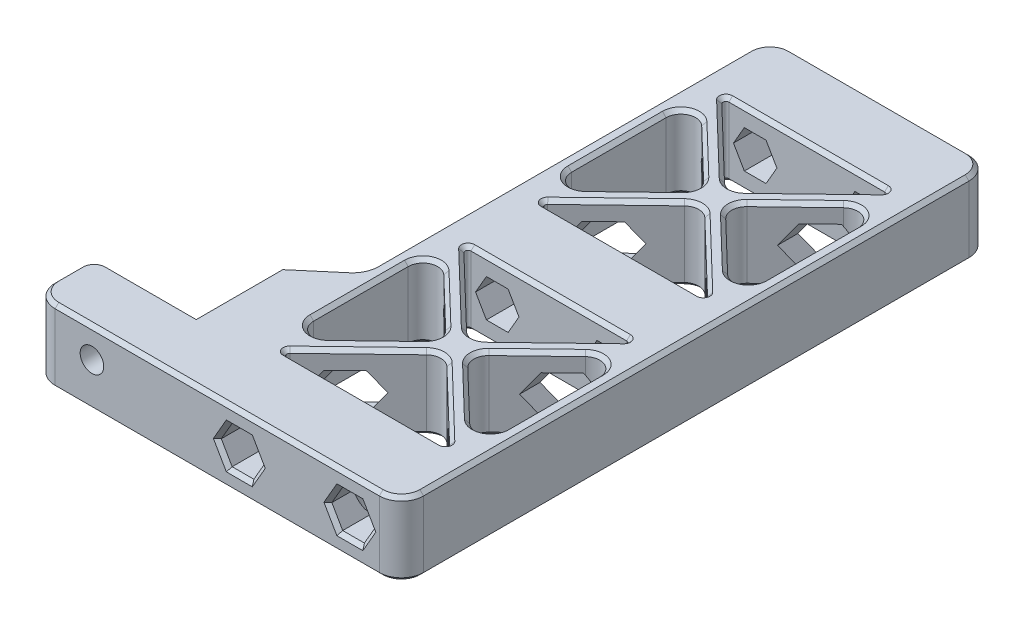
from build123d import *

# Parameters (mm, degrees)
SKETCH1_W               = 63.5
SKETCH1_H               = 101.6
BOSS_EXTRUDE1_DEPTH     = 12.7
CUT_EXTRUDE1_REACH      = 109.2
CUT_EXTRUDE3_DEPTH      = 62.237182332
CUT_EXTRUDE3_DEPTH_BACK = 62.237182332
CUT_EXTRUDE6_DEPTH      = 62.237182332
CUT_EXTRUDE6_DEPTH_BACK = 62.237182332
SKETCH8_R               = 2.032
CUT_EXTRUDE7_DEPTH      = 9.525
FILLET4_R               = 2.54
FILLET7_R               = 0.508
FILLET1_R               = 3.81
CHAMFER1_SIZE           = 0.635
CUT_EXTRUDE4_REACH      = 109.2
SKETCH5_R               = 2.032
SKETCH6_R               = 2.032
CUT_EXTRUDE5_DEPTH      = 98.26815502
FILLET3_R               = 2.54
CHAMFER3_SIZE           = 0.635


# Some blends are built 0.0001 mm under size
with BuildPart() as part:
    # Sketch1 → Boss-Extrude1 (new body)
    with BuildSketch(Plane(origin=(0, 0, 0), x_dir=(1, 0, 0), z_dir=(0, 1, 0))):
        Rectangle(SKETCH1_W, SKETCH1_H)
    extrude(amount=BOSS_EXTRUDE1_DEPTH)

    # Sketch2 → Cut-Extrude1 (cut, up to next)
    with BuildSketch(Plane(origin=(0, 0, -50.8), x_dir=(-1, 0, 0), z_dir=(0, 0, -1)), mode=Mode.PRIVATE) as cut_extrude1_sk1:
        Polygon((-19.120502306, 6.35), (-20.990251153, 9.5885), (-24.729748847, 9.5885), (-26.599497694, 6.35), (-24.729748847, 3.1115), (-20.990251153, 3.1115), align=None)
    cut_extrude1_tool1 = extrude(cut_extrude1_sk1.sketch, amount=-CUT_EXTRUDE1_REACH, mode=Mode.PRIVATE) & part.part
    # Sketch2 → Cut-Extrude1 (cut, up to next)
    with BuildSketch(Plane(origin=(0, 0, -50.8), x_dir=(-1, 0, 0), z_dir=(0, 0, -1)), mode=Mode.PRIVATE) as cut_extrude1_sk2:
        Polygon((-0.070502306, 6.35), (-1.940251153, 9.5885), (-5.679748847, 9.5885), (-7.549497694, 6.35), (-5.679748847, 3.1115), (-1.940251153, 3.1115), align=None)
    cut_extrude1_tool2 = extrude(cut_extrude1_sk2.sketch, amount=-CUT_EXTRUDE1_REACH, mode=Mode.PRIVATE) & part.part
    add(cut_extrude1_tool1.solids().sort_by_distance((22.86, 6.35, -50.8))[0], mode=Mode.SUBTRACT)
    add(cut_extrude1_tool2.solids().sort_by_distance((3.81, 6.35, -50.8))[0], mode=Mode.SUBTRACT)

    # Sketch3 → Cut-Extrude3 (cut, two sides: drawn at the far end of the back side and taken through both)
    with BuildSketch(Plane.XZ.offset(-CUT_EXTRUDE3_DEPTH_BACK)):
        Polygon((-6.35, 19.05), (-31.75, 40.64), (-31.75, -50.8), (-6.35, -50.8), (-6.35, 0), align=None)
    extrude(amount=CUT_EXTRUDE3_DEPTH + CUT_EXTRUDE3_DEPTH_BACK, mode=Mode.SUBTRACT)

    # Sketch7 → Cut-Extrude6 (cut, two sides: drawn at the far end of the back side and taken through both)
    with BuildSketch(Plane.XZ.offset(-CUT_EXTRUDE6_DEPTH_BACK)):
        Polygon((10.867675618, 22.225), (-3.81, 36.338149633), (-3.81, 20.224598806), (-3.81, 8.111850367), align=None)
        Polygon((27.377675618, 38.1), (-1.977675618, 38.1), (12.7, 23.986850367), align=None)
        Polygon((29.21, 36.338149633), (14.532324382, 22.225), (29.21, 8.111850367), align=None)
        Polygon((27.377675618, 6.35), (12.7, 20.463149633), (-1.977675618, 6.35), align=None)
        Polygon((27.377675618, -6.35), (-1.977675618, -6.35), (12.7, -20.463149633), align=None)
        Polygon((10.867675618, -22.225), (-3.81, -8.111850367), (-3.81, -36.338149633), align=None)
        Polygon((27.377675618, -38.1), (12.7, -23.986850367), (-1.977675618, -38.1), align=None)
        Polygon((29.21, -36.338149633), (29.21, -8.111850367), (14.532324382, -22.225), align=None)
    extrude(amount=CUT_EXTRUDE6_DEPTH + CUT_EXTRUDE6_DEPTH_BACK, mode=Mode.SUBTRACT)

    # Sketch8 → Cut-Extrude7 (cut)
    with BuildSketch(Plane.XZ):
        with Locations(Location((-27.94, 45.72, 0), (0, 0, 270))):
            Circle(SKETCH8_R)
        with Locations(Location((-15.24, 45.72, 0), (0, 0, 270))):
            Circle(SKETCH8_R)
        with Locations(Location((6.35, 44.45, 0), (0, 0, 270))):
            Circle(SKETCH8_R)
        with Locations(Location((19.05, 44.45, 0), (0, 0, 270))):
            Circle(SKETCH8_R)
        with Locations(Location((6.35, 0, 0), (0, 0, 270))):
            Circle(SKETCH8_R)
        with Locations(Location((19.05, 0, 0), (0, 0, 270))):
            Circle(SKETCH8_R)
        with Locations(Location((6.35, -44.45, 0), (0, 0, 270))):
            Circle(SKETCH8_R)
        with Locations(Location((19.05, -44.45, 0), (0, 0, 270))):
            Circle(SKETCH8_R)
    extrude(amount=-CUT_EXTRUDE7_DEPTH, mode=Mode.SUBTRACT)

    # Fillet4
    # the kernel refuses this fillet: 2.54 mm, written as the material it adds along each edge
    with BuildSketch(Plane(origin=(12.7, 0, -20.463149633), x_dir=(-0.7208330649018575, 0, 0.693108716251783), z_dir=(0, 1, 0)), Plane(origin=(12.7, 12.7, 20.463149633), x_dir=(-0.7208330649018564, 0, -0.693108716251784), z_dir=(0, -1, 0)), Plane(origin=(12.7, 0, 23.986850367), x_dir=(-0.7208330649018557, 0, 0.6931087162517849), z_dir=(0, 1, 0)), Plane(origin=(12.7, 12.7, -23.986850367), x_dir=(-0.7208330649018553, 0, -0.6931087162517852), z_dir=(0, -1, 0))) as fillet4_piece_1:
        with BuildLine():
            CenterArc((FILLET4_R * 0.961538461538, FILLET4_R), FILLET4_R, 182.246605428, 87.753394572)
            Line((-FILLET4_R * 0.0376928989535, FILLET4_R * 0.960799385088), (0, 0))
            Line((0, 0), (FILLET4_R * 0.961538461538, 0))
        make_face()
    extrude(amount=12.7)
    with BuildSketch(Plane(origin=(14.532324382, 12.7, 22.225), x_dir=(0.7208330649018564, 0, -0.6931087162517842), z_dir=(0, -1, 0)), Plane(origin=(14.532324382, 0, -22.225), x_dir=(0.7208330649018564, 0, 0.6931087162517842), z_dir=(0, 1, 0)), Plane(origin=(10.867675618, 0, -22.225), x_dir=(-0.7208330649018543, 0, -0.6931087162517862), z_dir=(0, 1, 0)), Plane(origin=(10.867675618, 0, 22.225), x_dir=(-0.7208330649018567, 0, -0.6931087162517838), z_dir=(0, 1, 0))) as fillet4_piece_2:
        with BuildLine():
            CenterArc((FILLET4_R * 1.04, FILLET4_R), FILLET4_R, 177.753394572, 92.246605428)
            Line((FILLET4_R * 0.0407686395081, FILLET4_R * 1.03920061491), (0, 0))
            Line((0, 0), (FILLET4_R * 1.04, 0))
        make_face()
    extrude(amount=12.7)
    with BuildSketch(Plane(origin=(29.21, 0, 8.111850367), x_dir=(0, 0, 1), z_dir=(0, 1, 0))) as fillet4_piece_3_section:
        with BuildLine():
            CenterArc((FILLET4_R * 2.34882221514, -FILLET4_R), FILLET4_R, 90, 133.876697286)
            Line((FILLET4_R * 1.62798915024, -FILLET4_R * 1.69310871625), (0, 0))
            Line((0, 0), (FILLET4_R * 2.34882221514, 0))
        make_face()
    fillet4_piece_3 = extrude(amount=12.7, mode=Mode.PRIVATE)
    fillet4_piece_3 = split(fillet4_piece_3, bisect_by=Plane(origin=(25.032036835, 3.635078153, 10.752436882), z_dir=(0.8660254037844393, -0.499999999999999, 0)), keep=Keep.TOP, mode=Mode.PRIVATE)
    fillet4_piece_3 = split(fillet4_piece_3, bisect_by=Plane(origin=(28.760529529, 2.606983064, 10.752436882), z_dir=(-0.8660254037844385, -0.5000000000000003, 0)), keep=Keep.TOP, mode=Mode.PRIVATE)
    add(fillet4_piece_3)
    with BuildSketch(Plane(origin=(29.21, 0, 8.111850367), x_dir=(0, 0, 1), z_dir=(0, 1, 0))) as fillet4_piece_4_section:
        with BuildLine():
            CenterArc((FILLET4_R * 2.34882221514, -FILLET4_R), FILLET4_R, 90, 133.876697286)
            Line((FILLET4_R * 1.62798915024, -FILLET4_R * 1.69310871625), (0, 0))
            Line((0, 0), (FILLET4_R * 2.34882221514, 0))
        make_face()
    fillet4_piece_4 = extrude(amount=12.7, mode=Mode.PRIVATE)
    fillet4_piece_4 = split(fillet4_piece_4, bisect_by=Plane(origin=(27.096164992, 7.210252996, 10.654436951), z_dir=(0.8660254037844393, -0.499999999999999, 0)), keep=Keep.TOP, mode=Mode.PRIVATE)
    fillet4_piece_4 = split(fillet4_piece_4, bisect_by=Plane(origin=(27.096164992, 5.489747004, 10.654436951), z_dir=(0.8660254037844385, 0.5000000000000003, 0)), keep=Keep.TOP, mode=Mode.PRIVATE)
    add(fillet4_piece_4)
    with BuildSketch(Plane(origin=(29.21, 0, 8.111850367), x_dir=(0, 0, 1), z_dir=(0, 1, 0))) as fillet4_piece_5_section:
        with BuildLine():
            CenterArc((FILLET4_R * 2.34882221514, -FILLET4_R), FILLET4_R, 90, 133.876697286)
            Line((FILLET4_R * 1.62798915024, -FILLET4_R * 1.69310871625), (0, 0))
            Line((0, 0), (FILLET4_R * 2.34882221514, 0))
        make_face()
    fillet4_piece_5 = extrude(amount=12.7, mode=Mode.PRIVATE)
    fillet4_piece_5 = split(fillet4_piece_5, bisect_by=Plane(origin=(28.760529529, 10.093016936, 10.752436882), z_dir=(-0.8660254037844393, 0.499999999999999, 0)), keep=Keep.TOP, mode=Mode.PRIVATE)
    fillet4_piece_5 = split(fillet4_piece_5, bisect_by=Plane(origin=(25.032036835, 9.064921847, 10.752436882), z_dir=(0.8660254037844385, 0.5000000000000003, 0)), keep=Keep.TOP, mode=Mode.PRIVATE)
    add(fillet4_piece_5)
    with BuildSketch(Plane(origin=(29.21, 0, 36.338149633), x_dir=(0, 0, -1), z_dir=(0, 1, 0))) as fillet4_piece_6_section:
        with BuildLine():
            CenterArc((FILLET4_R * 2.34882221514, FILLET4_R), FILLET4_R, 136.123302714, 133.876697286)
            Line((FILLET4_R * 1.62798915024, FILLET4_R * 1.69310871625), (0, 0))
            Line((0, 0), (FILLET4_R * 2.34882221514, 0))
        make_face()
    fillet4_piece_6 = extrude(amount=12.7, mode=Mode.PRIVATE)
    fillet4_piece_6 = split(fillet4_piece_6, bisect_by=Plane(origin=(28.760529529, 2.606983064, 33.697563118), z_dir=(-0.8660254037844385, -0.5000000000000003, 0)), keep=Keep.TOP, mode=Mode.PRIVATE)
    fillet4_piece_6 = split(fillet4_piece_6, bisect_by=Plane(origin=(25.032036835, 3.635078153, 33.697563118), z_dir=(0.8660254037844393, -0.499999999999999, 0)), keep=Keep.TOP, mode=Mode.PRIVATE)
    add(fillet4_piece_6)
    with BuildSketch(Plane(origin=(29.21, 0, 36.338149633), x_dir=(0, 0, -1), z_dir=(0, 1, 0))) as fillet4_piece_7_section:
        with BuildLine():
            CenterArc((FILLET4_R * 2.34882221514, FILLET4_R), FILLET4_R, 136.123302714, 133.876697286)
            Line((FILLET4_R * 1.62798915024, FILLET4_R * 1.69310871625), (0, 0))
            Line((0, 0), (FILLET4_R * 2.34882221514, 0))
        make_face()
    fillet4_piece_7 = extrude(amount=12.7, mode=Mode.PRIVATE)
    fillet4_piece_7 = split(fillet4_piece_7, bisect_by=Plane(origin=(27.096164992, 5.489747004, 33.795563049), z_dir=(0.8660254037844385, 0.5000000000000003, 0)), keep=Keep.TOP, mode=Mode.PRIVATE)
    fillet4_piece_7 = split(fillet4_piece_7, bisect_by=Plane(origin=(27.096164992, 7.210252996, 33.795563049), z_dir=(0.8660254037844393, -0.499999999999999, 0)), keep=Keep.TOP, mode=Mode.PRIVATE)
    add(fillet4_piece_7)
    with BuildSketch(Plane(origin=(29.21, 0, 36.338149633), x_dir=(0, 0, -1), z_dir=(0, 1, 0))) as fillet4_piece_8_section:
        with BuildLine():
            CenterArc((FILLET4_R * 2.34882221514, FILLET4_R), FILLET4_R, 136.123302714, 133.876697286)
            Line((FILLET4_R * 1.62798915024, FILLET4_R * 1.69310871625), (0, 0))
            Line((0, 0), (FILLET4_R * 2.34882221514, 0))
        make_face()
    fillet4_piece_8 = extrude(amount=12.7, mode=Mode.PRIVATE)
    fillet4_piece_8 = split(fillet4_piece_8, bisect_by=Plane(origin=(25.032036835, 9.064921847, 33.697563118), z_dir=(0.8660254037844385, 0.5000000000000003, 0)), keep=Keep.TOP, mode=Mode.PRIVATE)
    fillet4_piece_8 = split(fillet4_piece_8, bisect_by=Plane(origin=(28.760529529, 10.093016936, 33.697563118), z_dir=(-0.8660254037844393, 0.499999999999999, 0)), keep=Keep.TOP, mode=Mode.PRIVATE)
    add(fillet4_piece_8)
    with BuildSketch(Plane(origin=(29.21, 12.7, -36.338149633), x_dir=(0, 0, 1), z_dir=(0, -1, 0))) as fillet4_piece_9_section:
        with BuildLine():
            CenterArc((FILLET4_R * 2.34882221514, FILLET4_R), FILLET4_R, 136.123302714, 133.876697286)
            Line((FILLET4_R * 1.62798915024, FILLET4_R * 1.69310871625), (0, 0))
            Line((0, 0), (FILLET4_R * 2.34882221514, 0))
        make_face()
    fillet4_piece_9 = extrude(amount=12.7, mode=Mode.PRIVATE)
    fillet4_piece_9 = split(fillet4_piece_9, bisect_by=Plane(origin=(28.760529529, 10.093016936, -33.697563118), z_dir=(-0.8660254037844393, 0.499999999999999, 0)), keep=Keep.TOP, mode=Mode.PRIVATE)
    fillet4_piece_9 = split(fillet4_piece_9, bisect_by=Plane(origin=(25.032036835, 9.064921847, -33.697563118), z_dir=(0.8660254037844385, 0.5000000000000003, 0)), keep=Keep.TOP, mode=Mode.PRIVATE)
    add(fillet4_piece_9)
    with BuildSketch(Plane(origin=(29.21, 12.7, -36.338149633), x_dir=(0, 0, 1), z_dir=(0, -1, 0))) as fillet4_piece_10_section:
        with BuildLine():
            CenterArc((FILLET4_R * 2.34882221514, FILLET4_R), FILLET4_R, 136.123302714, 133.876697286)
            Line((FILLET4_R * 1.62798915024, FILLET4_R * 1.69310871625), (0, 0))
            Line((0, 0), (FILLET4_R * 2.34882221514, 0))
        make_face()
    fillet4_piece_10 = extrude(amount=12.7, mode=Mode.PRIVATE)
    fillet4_piece_10 = split(fillet4_piece_10, bisect_by=Plane(origin=(27.096164992, 7.210252996, -33.795563049), z_dir=(0.8660254037844393, -0.499999999999999, 0)), keep=Keep.TOP, mode=Mode.PRIVATE)
    fillet4_piece_10 = split(fillet4_piece_10, bisect_by=Plane(origin=(27.096164992, 5.489747004, -33.795563049), z_dir=(0.8660254037844385, 0.5000000000000003, 0)), keep=Keep.TOP, mode=Mode.PRIVATE)
    add(fillet4_piece_10)
    with BuildSketch(Plane(origin=(29.21, 12.7, -36.338149633), x_dir=(0, 0, 1), z_dir=(0, -1, 0))) as fillet4_piece_11_section:
        with BuildLine():
            CenterArc((FILLET4_R * 2.34882221514, FILLET4_R), FILLET4_R, 136.123302714, 133.876697286)
            Line((FILLET4_R * 1.62798915024, FILLET4_R * 1.69310871625), (0, 0))
            Line((0, 0), (FILLET4_R * 2.34882221514, 0))
        make_face()
    fillet4_piece_11 = extrude(amount=12.7, mode=Mode.PRIVATE)
    fillet4_piece_11 = split(fillet4_piece_11, bisect_by=Plane(origin=(25.032036835, 3.635078153, -33.697563118), z_dir=(0.8660254037844393, -0.499999999999999, 0)), keep=Keep.TOP, mode=Mode.PRIVATE)
    fillet4_piece_11 = split(fillet4_piece_11, bisect_by=Plane(origin=(28.760529529, 2.606983064, -33.697563118), z_dir=(-0.8660254037844385, -0.5000000000000003, 0)), keep=Keep.TOP, mode=Mode.PRIVATE)
    add(fillet4_piece_11)
    with BuildSketch(Plane(origin=(29.21, 0, -8.111850367), x_dir=(-0.7208330649018565, 0, -0.6931087162517838), z_dir=(0, 1, 0))) as fillet4_piece_12_section:
        with BuildLine():
            CenterArc((FILLET4_R * 2.34882221514, -FILLET4_R), FILLET4_R, 90, 133.876697286)
            Line((FILLET4_R * 1.62798915024, -FILLET4_R * 1.69310871625), (0, 0))
            Line((0, 0), (FILLET4_R * 2.34882221514, 0))
        make_face()
    fillet4_piece_12 = extrude(amount=12.7, mode=Mode.PRIVATE)
    fillet4_piece_12 = split(fillet4_piece_12, bisect_by=Plane(origin=(28.760529529, 2.606983063, -10.752436882), z_dir=(-0.8660254037844385, -0.5000000000000003, 0)), keep=Keep.TOP, mode=Mode.PRIVATE)
    fillet4_piece_12 = split(fillet4_piece_12, bisect_by=Plane(origin=(25.032036834, 3.635078153, -10.752436882), z_dir=(0.8660254037844393, -0.499999999999999, 0)), keep=Keep.TOP, mode=Mode.PRIVATE)
    add(fillet4_piece_12)
    with BuildSketch(Plane(origin=(29.21, 0, -8.111850367), x_dir=(-0.7208330649018565, 0, -0.6931087162517838), z_dir=(0, 1, 0))) as fillet4_piece_13_section:
        with BuildLine():
            CenterArc((FILLET4_R * 2.34882221514, -FILLET4_R), FILLET4_R, 90, 133.876697286)
            Line((FILLET4_R * 1.62798915024, -FILLET4_R * 1.69310871625), (0, 0))
            Line((0, 0), (FILLET4_R * 2.34882221514, 0))
        make_face()
    fillet4_piece_13 = extrude(amount=12.7, mode=Mode.PRIVATE)
    fillet4_piece_13 = split(fillet4_piece_13, bisect_by=Plane(origin=(27.096164992, 5.489747004, -10.654436951), z_dir=(0.8660254037844385, 0.5000000000000003, 0)), keep=Keep.TOP, mode=Mode.PRIVATE)
    fillet4_piece_13 = split(fillet4_piece_13, bisect_by=Plane(origin=(27.096164992, 7.210252996, -10.654436951), z_dir=(0.8660254037844393, -0.499999999999999, 0)), keep=Keep.TOP, mode=Mode.PRIVATE)
    add(fillet4_piece_13)
    with BuildSketch(Plane(origin=(29.21, 0, -8.111850367), x_dir=(-0.7208330649018565, 0, -0.6931087162517838), z_dir=(0, 1, 0))) as fillet4_piece_14_section:
        with BuildLine():
            CenterArc((FILLET4_R * 2.34882221514, -FILLET4_R), FILLET4_R, 90, 133.876697286)
            Line((FILLET4_R * 1.62798915024, -FILLET4_R * 1.69310871625), (0, 0))
            Line((0, 0), (FILLET4_R * 2.34882221514, 0))
        make_face()
    fillet4_piece_14 = extrude(amount=12.7, mode=Mode.PRIVATE)
    fillet4_piece_14 = split(fillet4_piece_14, bisect_by=Plane(origin=(25.032036834, 9.064921847, -10.752436882), z_dir=(0.8660254037844385, 0.5000000000000003, 0)), keep=Keep.TOP, mode=Mode.PRIVATE)
    fillet4_piece_14 = split(fillet4_piece_14, bisect_by=Plane(origin=(28.760529529, 10.093016937, -10.752436882), z_dir=(-0.8660254037844393, 0.499999999999999, 0)), keep=Keep.TOP, mode=Mode.PRIVATE)
    add(fillet4_piece_14)
    with BuildSketch(Plane(origin=(-3.81, 12.7, -8.111850367), x_dir=(0, 0, -1), z_dir=(0, -1, 0))) as fillet4_piece_15_section:
        with BuildLine():
            CenterArc((FILLET4_R * 2.34882221514, FILLET4_R), FILLET4_R, 136.123302714, 133.876697286)
            Line((FILLET4_R * 1.62798915024, FILLET4_R * 1.69310871625), (0, 0))
            Line((0, 0), (FILLET4_R * 2.34882221514, 0))
        make_face()
    fillet4_piece_15 = extrude(amount=12.7, mode=Mode.PRIVATE)
    fillet4_piece_15 = split(fillet4_piece_15, bisect_by=Plane(origin=(-2.479807991, 10.767267009, -10.873156358), z_dir=(0.8660254037844388, 0.49999999999999983, 0)), keep=Keep.TOP, mode=Mode.PRIVATE)
    fillet4_piece_15 = split(fillet4_piece_15, bisect_by=Plane(origin=(1.682563729, 9.142172289, -10.873156358), z_dir=(-0.8660254037844386, 0.5000000000000001, 0)), keep=Keep.TOP, mode=Mode.PRIVATE)
    add(fillet4_piece_15)
    with BuildSketch(Plane(origin=(-3.81, 12.7, -8.111850367), x_dir=(0, 0, -1), z_dir=(0, -1, 0))) as fillet4_piece_16_section:
        with BuildLine():
            CenterArc((FILLET4_R * 2.34882221514, FILLET4_R), FILLET4_R, 136.123302714, 133.876697286)
            Line((FILLET4_R * 1.62798915024, FILLET4_R * 1.69310871625), (0, 0))
            Line((0, 0), (FILLET4_R * 2.34882221514, 0))
        make_face()
    fillet4_piece_16 = extrude(amount=12.7, mode=Mode.PRIVATE)
    fillet4_piece_16 = split(fillet4_piece_16, bisect_by=Plane(origin=(-0.696895554, 7.679172085, -10.669091062), z_dir=(-0.8660254037844388, -0.49999999999999983, 0)), keep=Keep.TOP, mode=Mode.PRIVATE)
    fillet4_piece_16 = split(fillet4_piece_16, bisect_by=Plane(origin=(-0.696895554, 5.020827915, -10.669091062), z_dir=(-0.8660254037844386, 0.5000000000000001, 0)), keep=Keep.TOP, mode=Mode.PRIVATE)
    add(fillet4_piece_16)
    with BuildSketch(Plane(origin=(-3.81, 12.7, -8.111850367), x_dir=(0, 0, -1), z_dir=(0, -1, 0))) as fillet4_piece_17_section:
        with BuildLine():
            CenterArc((FILLET4_R * 2.34882221514, FILLET4_R), FILLET4_R, 136.123302714, 133.876697286)
            Line((FILLET4_R * 1.62798915024, FILLET4_R * 1.69310871625), (0, 0))
            Line((0, 0), (FILLET4_R * 2.34882221514, 0))
        make_face()
    fillet4_piece_17 = extrude(amount=12.7, mode=Mode.PRIVATE)
    fillet4_piece_17 = split(fillet4_piece_17, bisect_by=Plane(origin=(1.682563729, 3.557827711, -10.873156358), z_dir=(-0.8660254037844388, -0.49999999999999983, 0)), keep=Keep.TOP, mode=Mode.PRIVATE)
    fillet4_piece_17 = split(fillet4_piece_17, bisect_by=Plane(origin=(-2.479807991, 1.932732991, -10.873156358), z_dir=(0.8660254037844386, -0.5000000000000001, 0)), keep=Keep.TOP, mode=Mode.PRIVATE)
    add(fillet4_piece_17)
    with BuildSketch(Plane(origin=(-3.81, 0, -36.338149633), x_dir=(0.7208330649018562, 0, 0.6931087162517843), z_dir=(0, 1, 0))) as fillet4_piece_18_section:
        with BuildLine():
            CenterArc((FILLET4_R * 2.34882221514, -FILLET4_R), FILLET4_R, 90, 133.876697286)
            Line((FILLET4_R * 1.62798915024, -FILLET4_R * 1.69310871625), (0, 0))
            Line((0, 0), (FILLET4_R * 2.34882221514, 0))
        make_face()
    fillet4_piece_18 = extrude(amount=12.7, mode=Mode.PRIVATE)
    fillet4_piece_18 = split(fillet4_piece_18, bisect_by=Plane(origin=(-2.479807991, 1.93273299, -33.576843643), z_dir=(0.8660254037844386, -0.5000000000000001, 0)), keep=Keep.TOP, mode=Mode.PRIVATE)
    fillet4_piece_18 = split(fillet4_piece_18, bisect_by=Plane(origin=(1.682563729, 3.557827711, -33.576843643), z_dir=(-0.8660254037844388, -0.49999999999999983, 0)), keep=Keep.TOP, mode=Mode.PRIVATE)
    add(fillet4_piece_18)
    with BuildSketch(Plane(origin=(-3.81, 0, -36.338149633), x_dir=(0.7208330649018562, 0, 0.6931087162517843), z_dir=(0, 1, 0))) as fillet4_piece_19_section:
        with BuildLine():
            CenterArc((FILLET4_R * 2.34882221514, -FILLET4_R), FILLET4_R, 90, 133.876697286)
            Line((FILLET4_R * 1.62798915024, -FILLET4_R * 1.69310871625), (0, 0))
            Line((0, 0), (FILLET4_R * 2.34882221514, 0))
        make_face()
    fillet4_piece_19 = extrude(amount=12.7, mode=Mode.PRIVATE)
    fillet4_piece_19 = split(fillet4_piece_19, bisect_by=Plane(origin=(-0.696895554, 5.020827915, -33.780908938), z_dir=(-0.8660254037844386, 0.5000000000000001, 0)), keep=Keep.TOP, mode=Mode.PRIVATE)
    fillet4_piece_19 = split(fillet4_piece_19, bisect_by=Plane(origin=(-0.696895554, 7.679172085, -33.780908938), z_dir=(-0.8660254037844388, -0.49999999999999983, 0)), keep=Keep.TOP, mode=Mode.PRIVATE)
    add(fillet4_piece_19)
    with BuildSketch(Plane(origin=(-3.81, 0, -36.338149633), x_dir=(0.7208330649018562, 0, 0.6931087162517843), z_dir=(0, 1, 0))) as fillet4_piece_20_section:
        with BuildLine():
            CenterArc((FILLET4_R * 2.34882221514, -FILLET4_R), FILLET4_R, 90, 133.876697286)
            Line((FILLET4_R * 1.62798915024, -FILLET4_R * 1.69310871625), (0, 0))
            Line((0, 0), (FILLET4_R * 2.34882221514, 0))
        make_face()
    fillet4_piece_20 = extrude(amount=12.7, mode=Mode.PRIVATE)
    fillet4_piece_20 = split(fillet4_piece_20, bisect_by=Plane(origin=(1.682563729, 9.142172289, -33.576843643), z_dir=(-0.8660254037844386, 0.5000000000000001, 0)), keep=Keep.TOP, mode=Mode.PRIVATE)
    fillet4_piece_20 = split(fillet4_piece_20, bisect_by=Plane(origin=(-2.479807991, 10.76726701, -33.576843643), z_dir=(0.8660254037844388, 0.49999999999999983, 0)), keep=Keep.TOP, mode=Mode.PRIVATE)
    add(fillet4_piece_20)
    with BuildSketch(Plane(origin=(-3.81, 12.7, 36.338149633), x_dir=(0, 0, -1), z_dir=(0, -1, 0))) as fillet4_piece_21_section:
        with BuildLine():
            CenterArc((FILLET4_R * 2.34882221514, FILLET4_R), FILLET4_R, 136.123302714, 133.876697286)
            Line((FILLET4_R * 1.62798915024, FILLET4_R * 1.69310871625), (0, 0))
            Line((0, 0), (FILLET4_R * 2.34882221514, 0))
        make_face()
    fillet4_piece_21 = extrude(amount=12.7, mode=Mode.PRIVATE)
    fillet4_piece_21 = split(fillet4_piece_21, bisect_by=Plane(origin=(-2.479807991, 10.767267009, 33.576843642), z_dir=(0.8660254037844388, 0.49999999999999983, 0)), keep=Keep.TOP, mode=Mode.PRIVATE)
    fillet4_piece_21 = split(fillet4_piece_21, bisect_by=Plane(origin=(1.682563729, 9.142172289, 33.576843642), z_dir=(-0.8660254037844386, 0.5000000000000001, 0)), keep=Keep.TOP, mode=Mode.PRIVATE)
    add(fillet4_piece_21)
    with BuildSketch(Plane(origin=(-3.81, 12.7, 36.338149633), x_dir=(0, 0, -1), z_dir=(0, -1, 0))) as fillet4_piece_22_section:
        with BuildLine():
            CenterArc((FILLET4_R * 2.34882221514, FILLET4_R), FILLET4_R, 136.123302714, 133.876697286)
            Line((FILLET4_R * 1.62798915024, FILLET4_R * 1.69310871625), (0, 0))
            Line((0, 0), (FILLET4_R * 2.34882221514, 0))
        make_face()
    fillet4_piece_22 = extrude(amount=12.7, mode=Mode.PRIVATE)
    fillet4_piece_22 = split(fillet4_piece_22, bisect_by=Plane(origin=(-0.696895554, 7.679172085, 33.780908938), z_dir=(-0.8660254037844388, -0.49999999999999983, 0)), keep=Keep.TOP, mode=Mode.PRIVATE)
    fillet4_piece_22 = split(fillet4_piece_22, bisect_by=Plane(origin=(-0.696895554, 5.020827915, 33.780908938), z_dir=(-0.8660254037844386, 0.5000000000000001, 0)), keep=Keep.TOP, mode=Mode.PRIVATE)
    add(fillet4_piece_22)
    with BuildSketch(Plane(origin=(-3.81, 12.7, 36.338149633), x_dir=(0, 0, -1), z_dir=(0, -1, 0))) as fillet4_piece_23_section:
        with BuildLine():
            CenterArc((FILLET4_R * 2.34882221514, FILLET4_R), FILLET4_R, 136.123302714, 133.876697286)
            Line((FILLET4_R * 1.62798915024, FILLET4_R * 1.69310871625), (0, 0))
            Line((0, 0), (FILLET4_R * 2.34882221514, 0))
        make_face()
    fillet4_piece_23 = extrude(amount=12.7, mode=Mode.PRIVATE)
    fillet4_piece_23 = split(fillet4_piece_23, bisect_by=Plane(origin=(1.682563729, 3.557827711, 33.576843642), z_dir=(-0.8660254037844388, -0.49999999999999983, 0)), keep=Keep.TOP, mode=Mode.PRIVATE)
    fillet4_piece_23 = split(fillet4_piece_23, bisect_by=Plane(origin=(-2.479807991, 1.932732991, 33.576843642), z_dir=(0.8660254037844386, -0.5000000000000001, 0)), keep=Keep.TOP, mode=Mode.PRIVATE)
    add(fillet4_piece_23)
    with BuildSketch(Plane(origin=(-3.81, 0, 8.111850367), x_dir=(0.7208330649018558, 0, 0.6931087162517847), z_dir=(0, 1, 0))) as fillet4_piece_24_section:
        with BuildLine():
            CenterArc((FILLET4_R * 2.34882221514, -FILLET4_R), FILLET4_R, 90, 133.876697286)
            Line((FILLET4_R * 1.62798915024, -FILLET4_R * 1.69310871625), (0, 0))
            Line((0, 0), (FILLET4_R * 2.34882221514, 0))
        make_face()
    fillet4_piece_24 = extrude(amount=12.7, mode=Mode.PRIVATE)
    fillet4_piece_24 = split(fillet4_piece_24, bisect_by=Plane(origin=(-2.479807991, 1.93273299, 10.873156357), z_dir=(0.8660254037844386, -0.5000000000000001, 0)), keep=Keep.TOP, mode=Mode.PRIVATE)
    fillet4_piece_24 = split(fillet4_piece_24, bisect_by=Plane(origin=(1.682563729, 3.557827711, 10.873156357), z_dir=(-0.8660254037844388, -0.49999999999999983, 0)), keep=Keep.TOP, mode=Mode.PRIVATE)
    add(fillet4_piece_24)
    with BuildSketch(Plane(origin=(-3.81, 0, 8.111850367), x_dir=(0.7208330649018558, 0, 0.6931087162517847), z_dir=(0, 1, 0))) as fillet4_piece_25_section:
        with BuildLine():
            CenterArc((FILLET4_R * 2.34882221514, -FILLET4_R), FILLET4_R, 90, 133.876697286)
            Line((FILLET4_R * 1.62798915024, -FILLET4_R * 1.69310871625), (0, 0))
            Line((0, 0), (FILLET4_R * 2.34882221514, 0))
        make_face()
    fillet4_piece_25 = extrude(amount=12.7, mode=Mode.PRIVATE)
    fillet4_piece_25 = split(fillet4_piece_25, bisect_by=Plane(origin=(-0.696895554, 5.020827915, 10.669091062), z_dir=(-0.8660254037844386, 0.5000000000000001, 0)), keep=Keep.TOP, mode=Mode.PRIVATE)
    fillet4_piece_25 = split(fillet4_piece_25, bisect_by=Plane(origin=(-0.696895554, 7.679172085, 10.669091062), z_dir=(-0.8660254037844388, -0.49999999999999983, 0)), keep=Keep.TOP, mode=Mode.PRIVATE)
    add(fillet4_piece_25)
    with BuildSketch(Plane(origin=(-3.81, 0, 8.111850367), x_dir=(0.7208330649018558, 0, 0.6931087162517847), z_dir=(0, 1, 0))) as fillet4_piece_26_section:
        with BuildLine():
            CenterArc((FILLET4_R * 2.34882221514, -FILLET4_R), FILLET4_R, 90, 133.876697286)
            Line((FILLET4_R * 1.62798915024, -FILLET4_R * 1.69310871625), (0, 0))
            Line((0, 0), (FILLET4_R * 2.34882221514, 0))
        make_face()
    fillet4_piece_26 = extrude(amount=12.7, mode=Mode.PRIVATE)
    fillet4_piece_26 = split(fillet4_piece_26, bisect_by=Plane(origin=(1.682563729, 9.142172289, 10.873156357), z_dir=(-0.8660254037844386, 0.5000000000000001, 0)), keep=Keep.TOP, mode=Mode.PRIVATE)
    fillet4_piece_26 = split(fillet4_piece_26, bisect_by=Plane(origin=(-2.479807991, 10.76726701, 10.873156357), z_dir=(0.8660254037844388, 0.49999999999999983, 0)), keep=Keep.TOP, mode=Mode.PRIVATE)
    add(fillet4_piece_26)

    # Fillet7
    # the kernel refuses this fillet: 0.508 mm, written as the material it adds along each edge
    with BuildSketch(Plane(origin=(-1.977675618, 0, -6.35), x_dir=(1, 0, 0), z_dir=(0, 1, 0)), Plane(origin=(-1.977675618, 0, 6.35), x_dir=(0.7208330649018561, 0, 0.6931087162517844), z_dir=(0, 1, 0)), Plane(origin=(-1.977675618, 0, 38.1), x_dir=(1, 0, 0), z_dir=(0, 1, 0))) as fillet7_piece_1:
        with BuildLine():
            CenterArc((FILLET7_R * 2.48277510375, FILLET7_R), FILLET7_R, 133.876697286, 136.123302714)
            Line((FILLET7_R * 1.7896663875, FILLET7_R * 1.7208330649), (0, 0))
            Line((0, 0), (FILLET7_R * 2.48277510375, 0))
        make_face()
    extrude(amount=12.7)
    with BuildSketch(Plane(origin=(27.377675618, 12.7, -6.35), x_dir=(-0.7208330649018552, 0, -0.6931087162517852), z_dir=(0, -1, 0))) as fillet7_piece_2_section:
        with BuildLine():
            CenterArc((FILLET7_R * 2.48277510375, -FILLET7_R), FILLET7_R, 90, 136.123302714)
            Line((FILLET7_R * 1.7896663875, -FILLET7_R * 1.7208330649), (0, 0))
            Line((0, 0), (FILLET7_R * 2.48277510375, 0))
        make_face()
    fillet7_piece_2 = extrude(amount=12.7, mode=Mode.PRIVATE)
    fillet7_piece_2 = split(fillet7_piece_2, bisect_by=Plane(origin=(28.11408086, 8.973334996, -6.581688662), z_dir=(-0.866025403784329, 0.50000000000019, 0)), keep=Keep.TOP, mode=Mode.PRIVATE)
    fillet7_piece_2 = split(fillet7_piece_2, bisect_by=Plane(origin=(25.185892675, 8.798435713, -6.581688662), z_dir=(0.866025403784329, 0.50000000000019, 0)), keep=Keep.TOP, mode=Mode.PRIVATE)
    add(fillet7_piece_2)
    with BuildSketch(Plane(origin=(27.377675618, 12.7, -6.35), x_dir=(-0.7208330649018552, 0, -0.6931087162517852), z_dir=(0, -1, 0))) as fillet7_piece_3_section:
        with BuildLine():
            CenterArc((FILLET7_R * 2.48277510375, -FILLET7_R), FILLET7_R, 90, 136.123302714)
            Line((FILLET7_R * 1.7896663875, -FILLET7_R * 1.7208330649), (0, 0))
            Line((0, 0), (FILLET7_R * 2.48277510375, 0))
        make_face()
    fillet7_piece_3 = extrude(amount=12.7, mode=Mode.PRIVATE)
    fillet7_piece_3 = split(fillet7_piece_3, bisect_by=Plane(origin=(26.699781143, 6.52369603, -6.533153118), z_dir=(0.866025403784329, -0.50000000000019, 0)), keep=Keep.TOP, mode=Mode.PRIVATE)
    fillet7_piece_3 = split(fillet7_piece_3, bisect_by=Plane(origin=(26.699781143, 6.17630397, -6.533153118), z_dir=(0.866025403784329, 0.50000000000019, 0)), keep=Keep.TOP, mode=Mode.PRIVATE)
    add(fillet7_piece_3)
    with BuildSketch(Plane(origin=(27.377675618, 12.7, -6.35), x_dir=(-0.7208330649018552, 0, -0.6931087162517852), z_dir=(0, -1, 0))) as fillet7_piece_4_section:
        with BuildLine():
            CenterArc((FILLET7_R * 2.48277510375, -FILLET7_R), FILLET7_R, 90, 136.123302714)
            Line((FILLET7_R * 1.7896663875, -FILLET7_R * 1.7208330649), (0, 0))
            Line((0, 0), (FILLET7_R * 2.48277510375, 0))
        make_face()
    fillet7_piece_4 = extrude(amount=12.7, mode=Mode.PRIVATE)
    fillet7_piece_4 = split(fillet7_piece_4, bisect_by=Plane(origin=(25.185892675, 3.901564287, -6.581688662), z_dir=(0.866025403784329, -0.50000000000019, 0)), keep=Keep.TOP, mode=Mode.PRIVATE)
    fillet7_piece_4 = split(fillet7_piece_4, bisect_by=Plane(origin=(28.11408086, 3.726665004, -6.581688662), z_dir=(-0.866025403784329, -0.50000000000019, 0)), keep=Keep.TOP, mode=Mode.PRIVATE)
    add(fillet7_piece_4)
    with BuildSketch(Plane(origin=(27.377675618, 0, 6.35), x_dir=(-0.7208330649018556, 0, 0.6931087162517848), z_dir=(0, 1, 0))) as fillet7_piece_5_section:
        with BuildLine():
            CenterArc((FILLET7_R * 2.48277510375, -FILLET7_R), FILLET7_R, 90, 136.123302714)
            Line((FILLET7_R * 1.7896663875, -FILLET7_R * 1.7208330649), (0, 0))
            Line((0, 0), (FILLET7_R * 2.48277510375, 0))
        make_face()
    fillet7_piece_5 = extrude(amount=12.7, mode=Mode.PRIVATE)
    fillet7_piece_5 = split(fillet7_piece_5, bisect_by=Plane(origin=(28.11408086, 3.726665004, 6.581688662), z_dir=(-0.866025403784329, -0.50000000000019, 0)), keep=Keep.TOP, mode=Mode.PRIVATE)
    fillet7_piece_5 = split(fillet7_piece_5, bisect_by=Plane(origin=(25.185892675, 3.901564287, 6.581688662), z_dir=(0.866025403784329, -0.50000000000019, 0)), keep=Keep.TOP, mode=Mode.PRIVATE)
    add(fillet7_piece_5)
    with BuildSketch(Plane(origin=(27.377675618, 0, 6.35), x_dir=(-0.7208330649018556, 0, 0.6931087162517848), z_dir=(0, 1, 0))) as fillet7_piece_6_section:
        with BuildLine():
            CenterArc((FILLET7_R * 2.48277510375, -FILLET7_R), FILLET7_R, 90, 136.123302714)
            Line((FILLET7_R * 1.7896663875, -FILLET7_R * 1.7208330649), (0, 0))
            Line((0, 0), (FILLET7_R * 2.48277510375, 0))
        make_face()
    fillet7_piece_6 = extrude(amount=12.7, mode=Mode.PRIVATE)
    fillet7_piece_6 = split(fillet7_piece_6, bisect_by=Plane(origin=(26.699781143, 6.17630397, 6.533153118), z_dir=(0.866025403784329, 0.50000000000019, 0)), keep=Keep.TOP, mode=Mode.PRIVATE)
    fillet7_piece_6 = split(fillet7_piece_6, bisect_by=Plane(origin=(26.699781143, 6.52369603, 6.533153118), z_dir=(0.866025403784329, -0.50000000000019, 0)), keep=Keep.TOP, mode=Mode.PRIVATE)
    add(fillet7_piece_6)
    with BuildSketch(Plane(origin=(27.377675618, 0, 6.35), x_dir=(-0.7208330649018556, 0, 0.6931087162517848), z_dir=(0, 1, 0))) as fillet7_piece_7_section:
        with BuildLine():
            CenterArc((FILLET7_R * 2.48277510375, -FILLET7_R), FILLET7_R, 90, 136.123302714)
            Line((FILLET7_R * 1.7896663875, -FILLET7_R * 1.7208330649), (0, 0))
            Line((0, 0), (FILLET7_R * 2.48277510375, 0))
        make_face()
    fillet7_piece_7 = extrude(amount=12.7, mode=Mode.PRIVATE)
    fillet7_piece_7 = split(fillet7_piece_7, bisect_by=Plane(origin=(25.185892675, 8.798435713, 6.581688662), z_dir=(0.866025403784329, 0.50000000000019, 0)), keep=Keep.TOP, mode=Mode.PRIVATE)
    fillet7_piece_7 = split(fillet7_piece_7, bisect_by=Plane(origin=(28.11408086, 8.973334996, 6.581688662), z_dir=(-0.866025403784329, 0.50000000000019, 0)), keep=Keep.TOP, mode=Mode.PRIVATE)
    add(fillet7_piece_7)
    with BuildSketch(Plane(origin=(27.377675618, 12.7, 38.1), x_dir=(-0.7208330649018577, 0, -0.6931087162517826), z_dir=(0, -1, 0))) as fillet7_piece_8_section:
        with BuildLine():
            CenterArc((FILLET7_R * 2.48277510375, -FILLET7_R), FILLET7_R, 90, 136.123302714)
            Line((FILLET7_R * 1.7896663875, -FILLET7_R * 1.7208330649), (0, 0))
            Line((0, 0), (FILLET7_R * 2.48277510375, 0))
        make_face()
    fillet7_piece_8 = extrude(amount=12.7, mode=Mode.PRIVATE)
    fillet7_piece_8 = split(fillet7_piece_8, bisect_by=Plane(origin=(25.185892675, 8.798435713, 37.868311338), z_dir=(0.866025403784329, 0.50000000000019, 0)), keep=Keep.TOP, mode=Mode.PRIVATE)
    fillet7_piece_8 = split(fillet7_piece_8, bisect_by=Plane(origin=(28.11408086, 8.973334996, 37.868311338), z_dir=(-0.866025403784329, 0.50000000000019, 0)), keep=Keep.TOP, mode=Mode.PRIVATE)
    add(fillet7_piece_8)
    with BuildSketch(Plane(origin=(27.377675618, 12.7, 38.1), x_dir=(-0.7208330649018577, 0, -0.6931087162517826), z_dir=(0, -1, 0))) as fillet7_piece_9_section:
        with BuildLine():
            CenterArc((FILLET7_R * 2.48277510375, -FILLET7_R), FILLET7_R, 90, 136.123302714)
            Line((FILLET7_R * 1.7896663875, -FILLET7_R * 1.7208330649), (0, 0))
            Line((0, 0), (FILLET7_R * 2.48277510375, 0))
        make_face()
    fillet7_piece_9 = extrude(amount=12.7, mode=Mode.PRIVATE)
    fillet7_piece_9 = split(fillet7_piece_9, bisect_by=Plane(origin=(26.699781143, 6.17630397, 37.916846882), z_dir=(0.866025403784329, 0.50000000000019, 0)), keep=Keep.TOP, mode=Mode.PRIVATE)
    fillet7_piece_9 = split(fillet7_piece_9, bisect_by=Plane(origin=(26.699781143, 6.52369603, 37.916846882), z_dir=(0.866025403784329, -0.50000000000019, 0)), keep=Keep.TOP, mode=Mode.PRIVATE)
    add(fillet7_piece_9)
    with BuildSketch(Plane(origin=(27.377675618, 12.7, 38.1), x_dir=(-0.7208330649018577, 0, -0.6931087162517826), z_dir=(0, -1, 0))) as fillet7_piece_10_section:
        with BuildLine():
            CenterArc((FILLET7_R * 2.48277510375, -FILLET7_R), FILLET7_R, 90, 136.123302714)
            Line((FILLET7_R * 1.7896663875, -FILLET7_R * 1.7208330649), (0, 0))
            Line((0, 0), (FILLET7_R * 2.48277510375, 0))
        make_face()
    fillet7_piece_10 = extrude(amount=12.7, mode=Mode.PRIVATE)
    fillet7_piece_10 = split(fillet7_piece_10, bisect_by=Plane(origin=(28.11408086, 3.726665004, 37.868311338), z_dir=(-0.866025403784329, -0.50000000000019, 0)), keep=Keep.TOP, mode=Mode.PRIVATE)
    fillet7_piece_10 = split(fillet7_piece_10, bisect_by=Plane(origin=(25.185892675, 3.901564287, 37.868311338), z_dir=(0.866025403784329, -0.50000000000019, 0)), keep=Keep.TOP, mode=Mode.PRIVATE)
    add(fillet7_piece_10)
    with BuildSketch(Plane(origin=(-1.977675618, 0, -38.1), x_dir=(1, 0, 0), z_dir=(0, 1, 0))) as fillet7_piece_11:
        with BuildLine():
            CenterArc((FILLET7_R * 2.48277510375, -FILLET7_R), FILLET7_R, 90, 136.123302714)
            Line((FILLET7_R * 1.7896663875, -FILLET7_R * 1.7208330649), (0, 0))
            Line((0, 0), (FILLET7_R * 2.48277510375, 0))
        make_face()
    extrude(amount=12.7)
    with BuildSketch(Plane(origin=(27.377675618, 0, -38.1), x_dir=(-1, 0, 0), z_dir=(0, 1, 0))) as fillet7_piece_12_section:
        with BuildLine():
            CenterArc((FILLET7_R * 2.48277510375, FILLET7_R), FILLET7_R, 133.876697286, 136.123302714)
            Line((FILLET7_R * 1.7896663875, FILLET7_R * 1.7208330649), (0, 0))
            Line((0, 0), (FILLET7_R * 2.48277510375, 0))
        make_face()
    fillet7_piece_12 = extrude(amount=12.7, mode=Mode.PRIVATE)
    fillet7_piece_12 = split(fillet7_piece_12, bisect_by=Plane(origin=(25.185892673, 3.901564283, -37.868311339), z_dir=(0.8660254037844393, -0.499999999999999, 0)), keep=Keep.TOP, mode=Mode.PRIVATE)
    fillet7_piece_12 = split(fillet7_piece_12, bisect_by=Plane(origin=(28.114080862, 3.726665, -37.868311339), z_dir=(-0.8660254037844385, -0.5000000000000003, 0)), keep=Keep.TOP, mode=Mode.PRIVATE)
    add(fillet7_piece_12)
    with BuildSketch(Plane(origin=(27.377675618, 0, -38.1), x_dir=(-1, 0, 0), z_dir=(0, 1, 0))) as fillet7_piece_13_section:
        with BuildLine():
            CenterArc((FILLET7_R * 2.48277510375, FILLET7_R), FILLET7_R, 133.876697286, 136.123302714)
            Line((FILLET7_R * 1.7896663875, FILLET7_R * 1.7208330649), (0, 0))
            Line((0, 0), (FILLET7_R * 2.48277510375, 0))
        make_face()
    fillet7_piece_13 = extrude(amount=12.7, mode=Mode.PRIVATE)
    fillet7_piece_13 = split(fillet7_piece_13, bisect_by=Plane(origin=(26.699781144, 6.523696032, -37.916846886), z_dir=(0.8660254037844393, -0.499999999999999, 0)), keep=Keep.TOP, mode=Mode.PRIVATE)
    fillet7_piece_13 = split(fillet7_piece_13, bisect_by=Plane(origin=(26.699781144, 6.176303968, -37.916846886), z_dir=(0.8660254037844385, 0.5000000000000003, 0)), keep=Keep.TOP, mode=Mode.PRIVATE)
    add(fillet7_piece_13)
    with BuildSketch(Plane(origin=(27.377675618, 0, -38.1), x_dir=(-1, 0, 0), z_dir=(0, 1, 0))) as fillet7_piece_14_section:
        with BuildLine():
            CenterArc((FILLET7_R * 2.48277510375, FILLET7_R), FILLET7_R, 133.876697286, 136.123302714)
            Line((FILLET7_R * 1.7896663875, FILLET7_R * 1.7208330649), (0, 0))
            Line((0, 0), (FILLET7_R * 2.48277510375, 0))
        make_face()
    fillet7_piece_14 = extrude(amount=12.7, mode=Mode.PRIVATE)
    fillet7_piece_14 = split(fillet7_piece_14, bisect_by=Plane(origin=(28.114080862, 8.973335, -37.868311339), z_dir=(-0.8660254037844393, 0.499999999999999, 0)), keep=Keep.TOP, mode=Mode.PRIVATE)
    fillet7_piece_14 = split(fillet7_piece_14, bisect_by=Plane(origin=(25.185892673, 8.798435717, -37.868311339), z_dir=(0.8660254037844385, 0.5000000000000003, 0)), keep=Keep.TOP, mode=Mode.PRIVATE)
    add(fillet7_piece_14)

    # Fillet1
    fillet1_edges = [part.edges().sort_by_distance(p)[0] for p in [
        (-6.35, 6.35, 19.05),
        (-6.35, 6.35, -50.8),
        (-31.75, 6.35, 40.64),
        (-31.75, 6.35, 50.8),
        (31.75, 6.35, -50.8),
        (31.75, 6.35, 50.8),
    ]]
    fillet(fillet1_edges, radius=FILLET1_R)

    # Chamfer1
    chamfer1_edges = [part.edges().sort_by_distance(p)[0] for p in [
        (25.66462327, 4.73075, -50.8),
        (22.86, 3.1115, -50.8),
        (20.05537673, 4.73075, -50.8),
        (20.05537673, 7.96925, -50.8),
        (22.86, 9.5885, -50.8),
        (25.66462327, 7.96925, -50.8),
        (22.86, 3.1115, 50.8),
        (25.66462327, 4.73075, 50.8),
        (25.66462327, 7.96925, 50.8),
        (22.86, 9.5885, 50.8),
        (20.05537673, 7.96925, 50.8),
        (20.05537673, 4.73075, 50.8),
        (6.61462327, 4.73075, -50.8),
        (3.81, 3.1115, -50.8),
        (1.00537673, 4.73075, -50.8),
        (1.00537673, 7.96925, -50.8),
        (3.81, 9.5885, -50.8),
        (6.61462327, 7.96925, -50.8),
        (3.81, 3.1115, 50.8),
        (6.61462327, 4.73075, 50.8),
        (6.61462327, 7.96925, 50.8),
        (3.81, 9.5885, 50.8),
        (1.00537673, 7.96925, 50.8),
        (1.00537673, 4.73075, 50.8),
        (-27.94, 0, 47.752),
        (19.05, 0, 2.032),
        (6.35, 0, -42.418),
        (19.05, 0, -42.418),
        (-15.24, 0, 47.752),
        (6.35, 0, 46.482),
        (19.05, 0, 46.482),
        (6.35, 0, 2.032),
        (20.672990433, 12.7, -16.320513412),
        (20.672990433, 0, -16.320513412),
        (29.21, 12.7, -22.225),
        (29.21, 0, -22.225),
        (20.672990433, 12.7, -28.129486588),
        (20.672990433, 0, -28.129486588),
        (4.727009567, 12.7, -28.129486588),
        (4.727009567, 0, -28.129486588),
        (-3.81, 12.7, -22.225),
        (-3.81, 0, -22.225),
        (4.727009567, 12.7, -16.320513412),
        (4.727009567, 0, -16.320513412),
        (4.935489384, 12.7, -31.45272596),
        (4.935489384, 0, -31.45272596),
        (4.935489384, 12.7, -12.99727404),
        (4.935489384, 0, -12.99727404),
        (29.21, 12.7, 22.225),
        (29.21, 0, 22.225),
        (20.672990433, 12.7, 16.320513412),
        (20.672990433, 0, 16.320513412),
        (20.672990433, 12.7, 28.129486588),
        (20.672990433, 0, 28.129486588),
        (-3.81, 12.7, 22.225),
        (-3.81, 0, 22.225),
        (4.727009567, 12.7, 28.129486588),
        (4.727009567, 0, 28.129486588),
        (4.727009567, 12.7, 16.320513412),
        (4.727009567, 0, 16.320513412),
        (20.464510616, 12.7, 12.99727404),
        (20.464510616, 0, 12.99727404),
        (20.464510616, 12.7, 31.45272596),
        (20.464510616, 0, 31.45272596),
        (27.664972313, 0, -11.740845722),
        (27.664972313, 12.7, -11.740845722),
        (27.664972313, 0, -32.709154278),
        (27.664972313, 12.7, -32.709154278),
        (-1.763726396, 0, -32.863693784),
        (-1.763726396, 12.7, -32.863693784),
        (-1.763726396, 0, -11.586306216),
        (-1.763726396, 12.7, -11.586306216),
        (15.656973145, 0, -22.225),
        (15.656973145, 12.7, -22.225),
        (9.743026855, 0, -22.225),
        (9.743026855, 12.7, -22.225),
        (12.7, 0, -24.970551101),
        (12.7, 12.7, -24.970551101),
        (12.7, 0, -19.479448899),
        (12.7, 12.7, -19.479448899),
        (27.664972313, 0, 11.740845722),
        (27.664972313, 12.7, 11.740845722),
        (27.664972313, 0, 32.709154278),
        (27.664972313, 12.7, 32.709154278),
        (-1.763726396, 0, 32.863693784),
        (-1.763726396, 12.7, 32.863693784),
        (-1.763726396, 0, 11.586306216),
        (-1.763726396, 12.7, 11.586306216),
        (15.656973145, 0, 22.225),
        (15.656973145, 12.7, 22.225),
        (9.743026855, 0, 22.225),
        (9.743026855, 12.7, 22.225),
        (12.7, 0, 19.479448899),
        (12.7, 12.7, 19.479448899),
        (12.7, 0, 24.970551101),
        (12.7, 12.7, 24.970551101),
        (12.7, 12.7, 38.1),
        (12.7, 0, 38.1),
        (4.935489384, 0, 31.45272596),
        (4.935489384, 12.7, 31.45272596),
        (12.7, 12.7, 6.35),
        (12.7, 0, 6.35),
        (4.935489384, 12.7, 12.99727404),
        (4.935489384, 0, 12.99727404),
        (20.464510616, 0, -31.45272596),
        (20.464510616, 12.7, -31.45272596),
        (12.7, 12.7, -38.1),
        (12.7, 0, -38.1),
        (12.7, 12.7, -6.35),
        (12.7, 0, -6.35),
        (20.464510616, 12.7, -12.99727404),
        (20.464510616, 0, -12.99727404),
        (26.587639758, 0, 37.781793224),
        (26.587639758, 12.7, 37.781793224),
        (-1.187639758, 0, 37.781793224),
        (-1.187639758, 12.7, 37.781793224),
        (-1.187639758, 0, 6.668206776),
        (-1.187639758, 12.7, 6.668206776),
        (26.587639758, 0, 6.668206776),
        (26.587639758, 12.7, 6.668206776),
        (26.587639758, 0, -37.781793224),
        (26.587639758, 12.7, -37.781793224),
        (-1.187639758, 0, -37.781793224),
        (-1.187639758, 12.7, -37.781793224),
        (26.587639758, 0, -6.668206776),
        (26.587639758, 12.7, -6.668206776),
        (-1.187639758, 0, -6.668206776),
        (-1.187639758, 12.7, -6.668206776),
        (-31.75, 12.7, 44.695949105),
        (-31.75, 0, 44.695949105),
        (-19.05, 0, 29.845),
        (-6.35, 0, -14.850949105),
        (12.7, 0, -50.8),
        (31.75, 0, 0),
        (0, 0, 50.8),
        (-5.234076836, 0, -49.684076836),
        (-30.634076836, 0, 49.684076836),
        (30.634076836, 0, 49.684076836),
        (30.634076836, 0, -49.684076836),
        (-31.398137449, 0, 40.802715485),
        (-19.05, 12.7, 29.845),
        (-6.35, 12.7, -14.850949105),
        (0, 12.7, 50.8),
        (31.75, 12.7, 0),
        (12.7, 12.7, -50.8),
        (-5.234076836, 12.7, -49.684076836),
        (-30.634076836, 12.7, 49.684076836),
        (30.634076836, 12.7, 49.684076836),
        (30.634076836, 12.7, -49.684076836),
        (-31.398137449, 12.7, 40.802715485),
        (-6.701862551, 0, 18.887284515),
        (-6.701862551, 12.7, 18.887284515),
    ]]
    chamfer(chamfer1_edges, length=CHAMFER1_SIZE)

    # Cut-Extrude4: up to this plane
    cut_extrude4_end = Plane(origin=(6.737082729, 12.7, 7.925979681), z_dir=(-0.6476484200955402, 0, -0.7619393177594597))
    # Sketch5 → Cut-Extrude4 (cut, up to the surface)
    with BuildSketch(Plane.XY.offset(50.8), mode=Mode.PRIVATE) as cut_extrude4_sk1:
        with Locations((-21.59, 7.62)):
            Circle(SKETCH5_R)
    cut_extrude4_tool1 = split(extrude(cut_extrude4_sk1.sketch, amount=-CUT_EXTRUDE4_REACH, mode=Mode.PRIVATE), bisect_by=cut_extrude4_end, keep=Keep.BOTH, mode=Mode.PRIVATE)
    add(cut_extrude4_tool1.solids().sort_by_distance((-21.59, 7.62, 50.8))[0], mode=Mode.SUBTRACT)

    # Sketch6 → Cut-Extrude5 (cut, through all)
    with BuildSketch(Plane.XY.offset(40.259)):
        with BuildLine():
            ThreePointArc((-21.649095458, 3.175392849), (-19.393138756, 3.755827944), (-17.74051708, 5.3975))
            Line((-17.74051708, 5.3975), (-13.524416739, 12.7))
            Line((-13.524416739, 12.7), (-31.75, 12.7))
            Line((-31.75, 12.7), (-31.75, 3.175392849))
            Line((-31.75, 3.175392849), (-21.649095458, 3.175392849))
        make_face()
        with Locations((-21.59, 7.62)):
            Circle(SKETCH6_R, mode=Mode.SUBTRACT)
    extrude(amount=-CUT_EXTRUDE5_DEPTH, mode=Mode.SUBTRACT)

    # Fillet3
    # the kernel refuses this fillet: 2.54 mm, written as the material it takes off along each edge
    with BuildSketch(Plane(origin=(-31.090251937, 18.625710474, 40.259), x_dir=(1, 0, 0), z_dir=(0, -1, 0))) as fillet3_piece_1:
        with BuildLine():
            CenterArc((1.880251937, 2.54), FILLET3_R, 180, 90)
            Line((-0.659748063, 2.54), (-0.913748063, 2.54))
            ThreePointArc((-0.913748063, 2.54), (-0.913748063, 2.142898209), (-0.210016796, -0.142859881))
            Line((-0.210016796, -0.142859881), (0, -0.254))
            Line((0, -0.254), (1.880251937, -0.254))
            Line((1.880251937, -0.254), (1.880251937, 0))
        make_face()
    extrude(amount=15.450317625, mode=Mode.SUBTRACT)

    # Chamfer3
    chamfer3_edges = [part.edges().sort_by_distance(p)[0] for p in [
        (-29.938224384, 12.7, 40.365630064),
        (-21.36720837, 12.7, 40.259),
    ]]
    chamfer(chamfer3_edges, length=CHAMFER3_SIZE - 0.0001)  # a hair under: the kernel refuses the full size


solid = part.part
